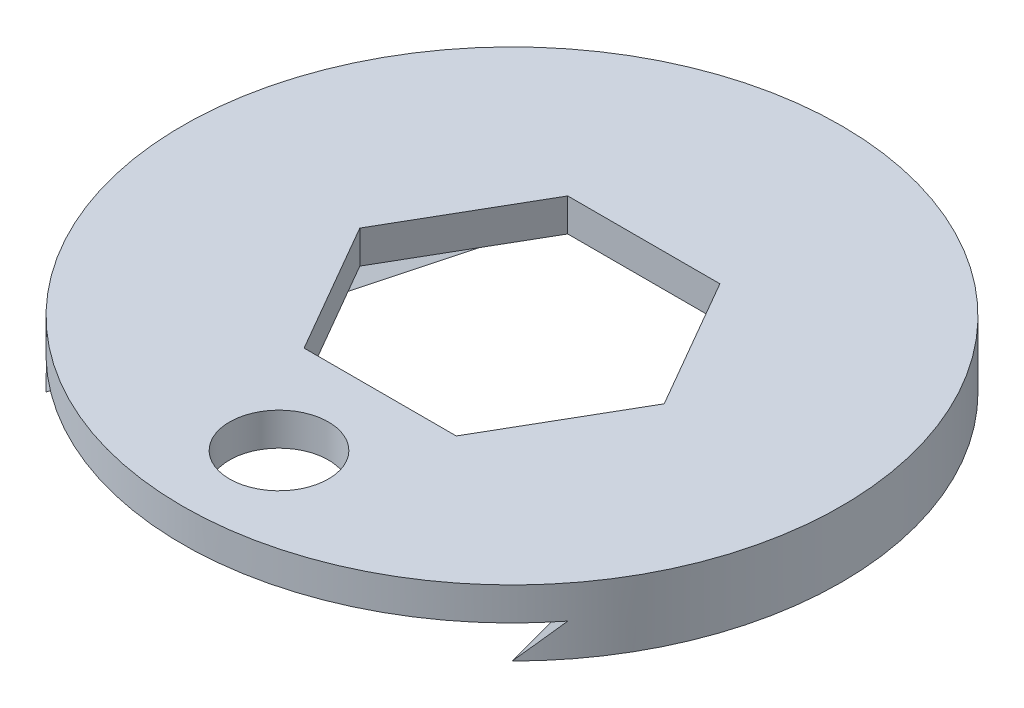
from build123d import *

# Parameters (mm, degrees)
SKETCH1_R               = 50
BOSS_EXTRUDE1_DEPTH     = 5
BOSS_EXTRUDE2_START     = -5
BOSS_EXTRUDE2_DEPTH     = 5
DRAFT1_ANGLE            = -45
CUT_EXTRUDE2_DEPTH      = 71.887234394
CUT_EXTRUDE2_DEPTH_BACK = 71.887234394
SKETCH1_8_R             = 7.5
CUT_EXTRUDE3_DEPTH      = 71.887234394


with BuildPart() as part:
    # Sketch1 → Boss-Extrude1 (new body)
    with BuildSketch(Plane(origin=(0, 0, 0), x_dir=(1, 0, 0), z_dir=(0, 1, 0))):
        Circle(SKETCH1_R)
    extrude(amount=BOSS_EXTRUDE1_DEPTH)

    # Sketch1<5> → Boss-Extrude2 (add)
    with BuildSketch(Plane(origin=(0, 0, 0), x_dir=(1, 0, 0), z_dir=(0, 1, 0)).offset(BOSS_EXTRUDE2_START)):
        with BuildLine():
            ThreePointArc((-12.940952255, 48.296291314), (-48.296291314, 12.940952255), (-35.355339059, -35.355339059))
            Line((-35.355339059, -35.355339059), (-12.940952255, 48.296291314))
        make_face()
        with BuildLine():
            Line((12.940952255, 48.296291314), (35.355339059, -35.355339059))
            ThreePointArc((35.355339059, -35.355339059), (48.296291314, 12.940952255), (12.940952255, 48.296291314))
        make_face()
    extrude(amount=BOSS_EXTRUDE2_DEPTH)

    # Draft1
    draft1_faces = [part.faces().sort_by_distance(p)[0] for p in [
        (24.148145657, -2.5, -6.470476128),
        (-24.148145657, -2.5, -6.470476128),
    ]]
    draft(draft1_faces, Plane(origin=(0, -5, 0), x_dir=(0, 0, -1), z_dir=(0, -1, 0)), DRAFT1_ANGLE)

    # Sketch1<8> → Cut-Extrude2 (cut, two sides: drawn at the far end of the back side and taken through both)
    with BuildSketch(Plane(origin=(0, 0, 0), x_dir=(1, 0, 0), z_dir=(0, 1, 0)).offset(-CUT_EXTRUDE2_DEPTH_BACK)):
        with Locations((0, -35.355339059)):
            Circle(SKETCH1_8_R)
    extrude(amount=CUT_EXTRUDE2_DEPTH + CUT_EXTRUDE2_DEPTH_BACK, mode=Mode.SUBTRACT)

    # Sketch2 → Cut-Extrude3 (cut, through all)
    with BuildSketch(Plane.XZ):
        Polygon((23.094010768, 0), (11.547005384, 20), (-11.547005384, 20), (-23.094010768, 0), (-11.547005384, -20), (11.547005384, -20), align=None)
    extrude(amount=-CUT_EXTRUDE3_DEPTH, mode=Mode.SUBTRACT)


solid = part.part
